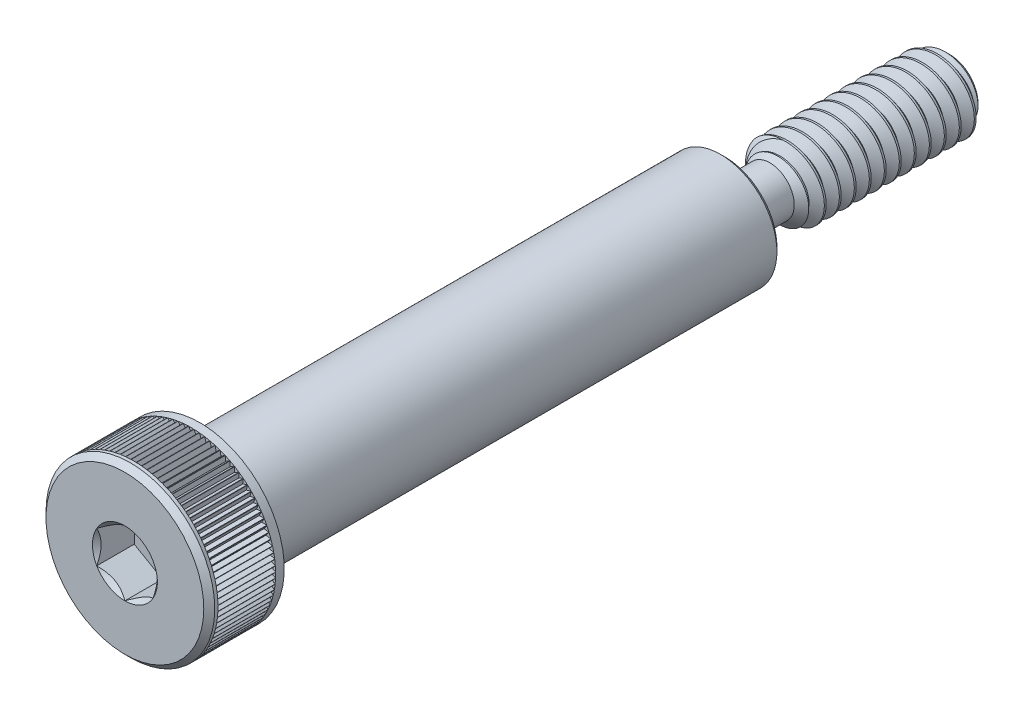
from build123d import *

# Parameters (mm, degrees)
SKETCH12_R          = 3.175
BOSS_EXTRUDE1_DEPTH = 19.05
CHAMFER1_SIZE       = 0.79375
CHAMFER2_SIZE       = 0.46434375
FILLET1_R           = 0.3175
CUT_EXTRUDE2_DEPTH  = 3.175
CUT_SWEEP1_PITCH    = 1.27
SKETCH14_R          = 1.5875
BOSS_EXTRUDE2_DEPTH = 17.145
CUT_EXTRUDE5_DEPTH  = 2.439590625
CIRPATTERN1_COUNT   = 99


with BuildPart() as part:
    # Sketch13 → Revolve1 (revolve)
    with BuildSketch(Plane(origin=(0, 0, 0), x_dir=(0, 0, -1), z_dir=(1, 0, 0)), mode=Mode.PRIVATE) as revolve1_sk:
        Polygon((0, 0), (0, 7.14375), (6.35, 7.14375), (6.35, 4.4053125), (7.62, 4.4053125), (7.9771875, 4.7625), (50.4428125, 4.7625), (50.8, 4.4053125), (50.8, 0), align=None)
    revolve(revolve1_sk.sketch.rotate(Axis((0, 0, -50.8), (0, 0, 1)), 90), axis=Axis((0, 0, -50.8), (0, 0, 1)))

    # Sketch12 → Boss-Extrude1 (add)
    with BuildSketch(Plane(origin=(0, 0, -50.8), x_dir=(-1, 0, 0), z_dir=(0, 0, -1))):
        Circle(SKETCH12_R)
    extrude(amount=BOSS_EXTRUDE1_DEPTH)

    # Sketch5 → Cut-Revolve1 (revolve, cut)
    with BuildSketch(Plane(origin=(0, 0, 0), x_dir=(0, 0, -1), z_dir=(1, 0, 0))):
        Polygon((50.8, 3.175), (55.72125, 3.175), (54.61, 2.06375), (50.8, 2.06375), align=None)
    revolve(axis=Axis((0, 0, -50.8), (0, 0, 1)), mode=Mode.SUBTRACT)

    # Chamfer1
    chamfer1_edges = [part.edges().sort_by_distance(p)[0] for p in [
        (3.175, 0, -69.85),
    ]]
    chamfer(chamfer1_edges, length=CHAMFER1_SIZE)

    # Chamfer2
    chamfer2_edges = [part.edges().sort_by_distance(p)[0] for p in [
        (7.14375, 0, 0),
    ]]
    chamfer(chamfer2_edges, length=CHAMFER2_SIZE)

    # Fillet1
    fillet1_edges = [part.edges().sort_by_distance(p)[0] for p in [
        (0, -2.06375, -50.8),
    ]]
    fillet(fillet1_edges, radius=FILLET1_R)

    # Sketch8 → Cut-Extrude2 (cut)
    with BuildSketch(Plane.XY):
        Polygon((2.38125, 1.374815329), (0, 2.749630657), (-2.38125, 1.374815329), (-2.38125, -1.374815329), (0, -2.749630657), (2.38125, -1.374815329), align=None)
    extrude(amount=-CUT_EXTRUDE2_DEPTH, mode=Mode.SUBTRACT)

    # Cut-Extrude4 cone 1 section (through the dimple's axis) → Cut-Extrude4 (revolve, cut)
    with BuildSketch(Plane(origin=(0, 0, 0), x_dir=(0, -1, 0), z_dir=(1, 0, 0))):
        Polygon((0, 0), (2.749630657, 0), (0, 2.749630657), align=None)
    revolve(axis=Axis((0, 0, 0), (0, 0, -1)), mode=Mode.SUBTRACT)


with BuildPart() as body_2:
    # Split1: the piece on the far side of the plane
    add(part.part)
    split(bisect_by=Plane.XY.offset(-50.8), keep=Keep.BOTTOM)

    # Cut-Sweep1: the profile of Sketch4 screwed along a right-hand helix of 14 turns, 8 arcs to a turn; built about Z, then put on its axis
    cut_sweep1_z = Axis((0, 0, 0), (0, 0, 1))
    cut_sweep1_corners = [(2.350110803, 0, -0.47625), (2.350110803, 0, -0.635), (3.243740766, 0, -1.1509375), (3.243740766, 0, -0.555625), (3.243740766, 0, 0.0396875)]
    with BuildLine(mode=Mode.PRIVATE) as cut_sweep1_profile:
        Line(cut_sweep1_corners[0], cut_sweep1_corners[1])
        Line(cut_sweep1_corners[1], cut_sweep1_corners[2])
        Line(cut_sweep1_corners[2], cut_sweep1_corners[3])
        Line(cut_sweep1_corners[3], cut_sweep1_corners[4])
        Line(cut_sweep1_corners[4], cut_sweep1_corners[0])
    cut_sweep1_cap = Face(cut_sweep1_profile.wire())
    cut_sweep1_turn_angles = [0, 22.5, 45, 67.5, 90, 112.5, 135, 157.5, 180, 202.5, 225, 247.5, 270, 292.5, 315, 337.5, 360]
    cut_sweep1_turn_weights = [1, 0.9238795325112867, 1, 0.9238795325112867, 1, 0.9238795325112867, 1, 0.9238795325112867, 1, 0.9238795325112867, 1, 0.9238795325112867, 1, 0.9238795325112867, 1, 0.9238795325112867, 1]
    cut_sweep1_turn_rails = [Edge.make_bspline([Vector(p[0], p[1], 0).rotate(cut_sweep1_z, cut_sweep1_turn_angles[k]) / cut_sweep1_turn_weights[k] + Vector(0, 0, p[2] + CUT_SWEEP1_PITCH * cut_sweep1_turn_angles[k] / 360) for k in range(17)], [0, 0, 0, 1, 1, 2, 2, 3, 3, 4, 4, 5, 5, 6, 6, 7, 7, 8, 8, 8], 2, cut_sweep1_turn_weights) for p in cut_sweep1_corners]
    cut_sweep1_turn_sides = [Face.make_surface_from_curves(cut_sweep1_turn_rails[p[0]], cut_sweep1_turn_rails[p[1]]) for p in [(0, 1), (1, 2), (2, 3), (3, 4), (4, 0)]]
    cut_sweep1 = Plane(origin=(0, 0, -69.85), x_dir=(0, 1, 0), z_dir=(0, 0, 1)) * Solid(Shell([*[p.moved(Location((0, 0, CUT_SWEEP1_PITCH * i))) for i in range(14) for p in cut_sweep1_turn_sides], cut_sweep1_cap, cut_sweep1_cap.rotate(cut_sweep1_z, 5040).moved(Location((0, 0, CUT_SWEEP1_PITCH * 5040 / 360)))]))
    add(cut_sweep1, mode=Mode.SUBTRACT)


with BuildPart() as part_1:
    add(part.part)

    # Split1
    split(bisect_by=Plane.XY.offset(-50.8), keep=Keep.TOP)

    add(body_2.part)  # Boss-Extrude2 merges body 2
    # Sketch14 → Boss-Extrude2 (add)
    with BuildSketch(Plane(origin=(0, 0, -50.8), x_dir=(-1, 0, 0), z_dir=(0, 0, -1))):
        Circle(SKETCH14_R)
    extrude(amount=BOSS_EXTRUDE2_DEPTH)

    # Sketch11 → Cut-Extrude5 (cut, symmetric)
    with BuildSketch(Plane.XY.offset(-3.175)):
        Polygon((0, 6.772275), (0.214471191, 7.14375), (-0.214471191, 7.14375), align=None)
    cut_extrude5 = extrude(amount=CUT_EXTRUDE5_DEPTH, both=True, mode=Mode.SUBTRACT)

    # CirPattern1: Cut-Extrude5 ×99 about axis
    cirpattern1_axis = Axis((0, 0, 0), (0, 0, 1))
    for i in range(1, CIRPATTERN1_COUNT):
        add(cut_extrude5.rotate(cirpattern1_axis, i * 360 / CIRPATTERN1_COUNT), mode=Mode.SUBTRACT)


solid = part_1.part
